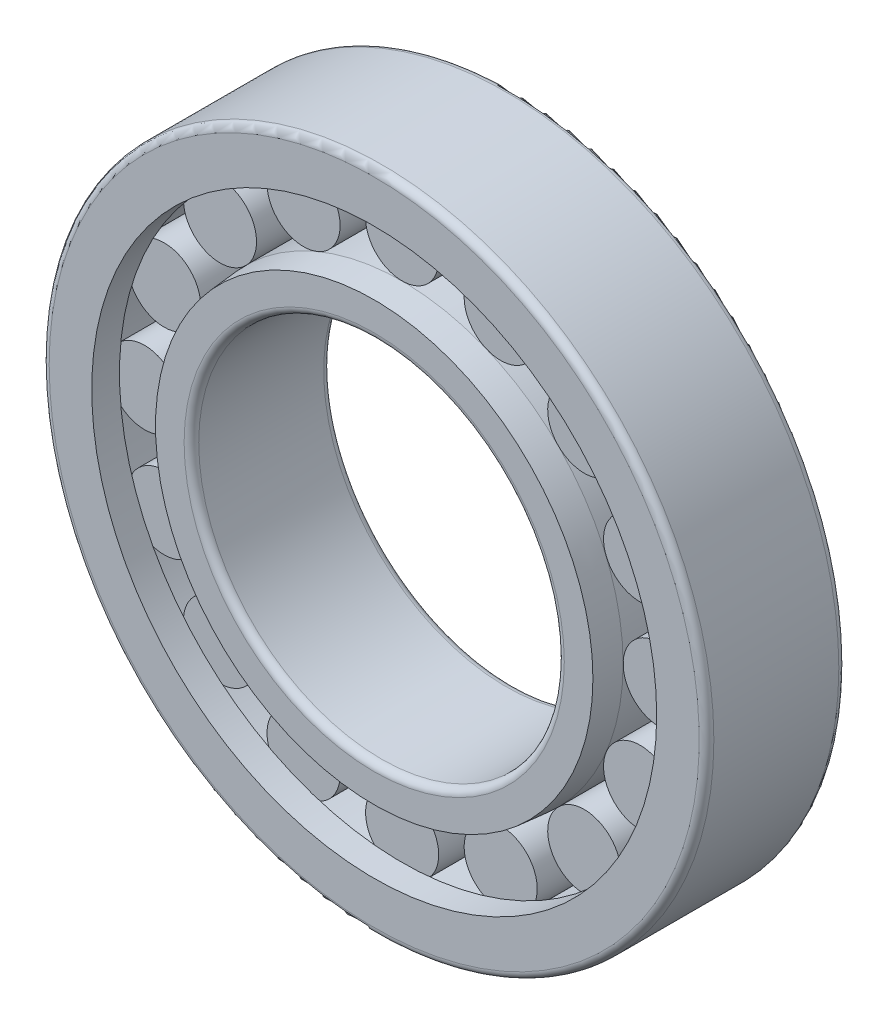
from build123d import *

# Parameters (mm, degrees)
BASESKE_W            = 12.6
BASESKE_H            = 5.5
FILLET1_R            = 1.1
CIRPATTERNBALL_COUNT = 16


with BuildPart() as part:
    # BaseSke → Roller (revolve)
    with BuildSketch(Plane(origin=(0, 0, 0), x_dir=(0, 0, -1), z_dir=(1, 0, 0))):
        with Locations((0, 36)):
            Rectangle(BASESKE_W, BASESKE_H)
    roller = revolve(axis=Axis((0, 38.75, 6.3), (0, 0, -1)))

    # OuterRaceSke → OuterRace (revolve)
    with BuildSketch(Plane(origin=(0, 0, 0), x_dir=(0, 0, -1), z_dir=(1, 0, 0))):
        Polygon((-10.5, 50), (10.5, 50), (10.5, 42.5), (6.325, 42.5), (6.325, 44.23), (-6.325, 44.23), (-6.325, 42.5), (-10.5, 42.5), align=None)
    revolve(axis=Axis((0, 0, 50.391616343), (0, 0, -1)))

    # InnerRaceSke → InnerRace (revolve)
    with BuildSketch(Plane(origin=(0, 0, 0), x_dir=(0, 0, -1), z_dir=(1, 0, 0))):
        Polygon((-10.5, 27.5), (10.5, 27.5), (10.5, 35), (6.325, 35), (6.325, 33.27), (-6.325, 33.27), (-6.325, 35), (-10.5, 35), align=None)
    revolve(axis=Axis((0, 0, 70.862590906), (0, 0, -1)))

    # Fillet1
    fillet1_edges = [part.edges().sort_by_distance(p)[0] for p in [
        (0, -27.5, 10.5),
        (0, -50, -10.5),
        (0, -50, 10.5),
        (0, -27.5, -10.5),
    ]]
    fillet(fillet1_edges, radius=FILLET1_R)

    # NJSke → NJ (revolve, cut)
    with BuildSketch(Plane(origin=(0, 0, 0), x_dir=(0, 0, -1), z_dir=(1, 0, 0))):
        Polygon((10.5, 35), (6.325, 35), (6.325, 33.27), (10.5, 32.90473483), align=None)
    nj = revolve(axis=Axis((0, 0, 35.607790457), (0, 0, -1)), mode=Mode.SUBTRACT)

    # NU: NJ across plane
    add(nj.mirror(Plane.XY), mode=Mode.SUBTRACT)

    # CirPatternBall: Roller ×16 about axis
    cirpatternball_axis = Axis((0, 0, 50.391616343), (0, 0, -1))
    for i in range(1, CIRPATTERNBALL_COUNT):
        add(roller.rotate(cirpatternball_axis, i * 360 / CIRPATTERNBALL_COUNT))


solid = part.part
